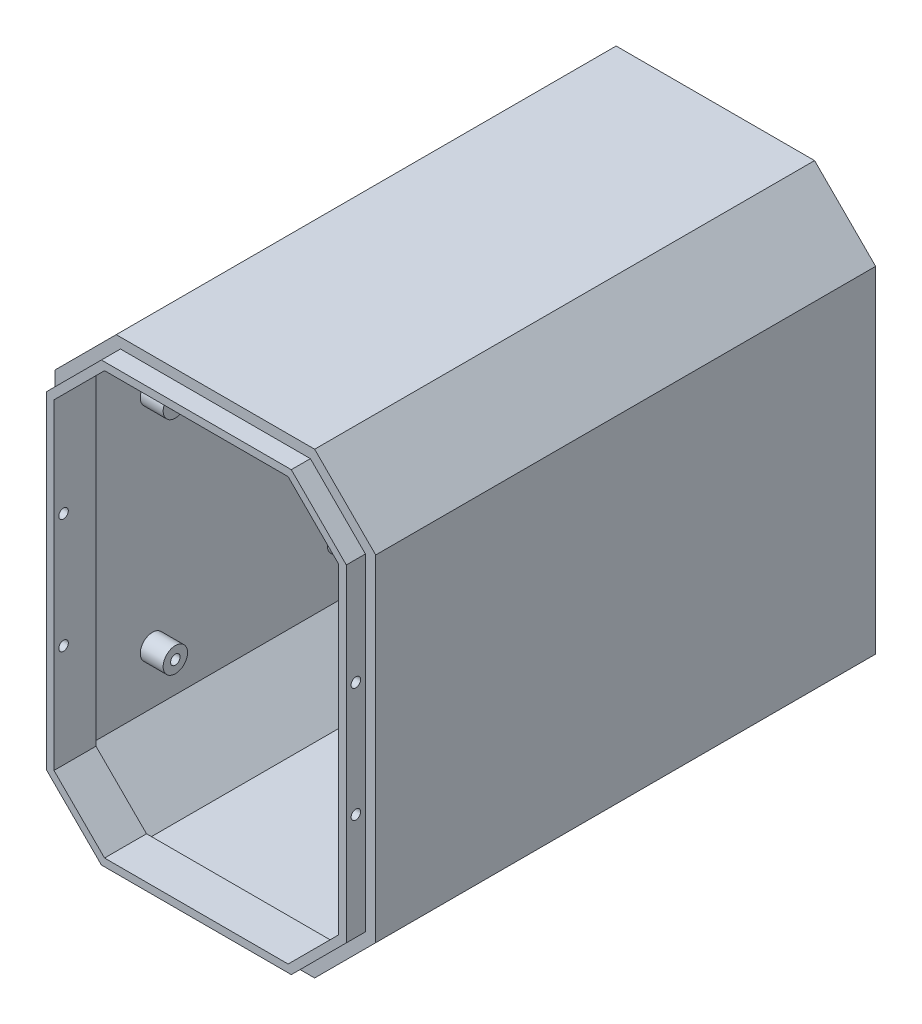
from build123d import *

# Parameters (mm, degrees)
BOSS_1_DEPTH   = 131
CUT_2_DEPTH    = 96.975
CUT_3_DEPTH    = 31.725
S_CUT4_W       = 8
S_CUT4_H       = 28
POCKET_4_DEPTH = 2.7
S_HOLE5_R      = 6
HOLE_5_DEPTH   = 2.7
S_HOLE6_R      = 1.6
HOLE_6_DEPTH   = 2.7
S_HOLE7_R      = 1.6
HOLE_7_DEPTH   = 2.7
S_HOLE8_R      = 1.6
HOLE_8_DEPTH   = 2.7
S_HOLE9_R      = 1.6
HOLE_9_DEPTH   = 2.7
BOSS_10_DEPTH  = 6
BOSS_11_DEPTH  = 5.1
S_CYL12_R      = 3.2
BOSS_12_DEPTH  = 6.5
S_CYL13_R      = 3.2
BOSS_13_DEPTH  = 6.5
S_CYL14_R      = 3.2
BOSS_14_DEPTH  = 6.5
S_CYL15_R      = 3.2
BOSS_15_DEPTH  = 6.5
CUT_16_DEPTH   = 11.2
S_HOLE17_R     = 1.25
HOLE_17_DEPTH  = 2.7
S_HOLE18_R     = 1.25
HOLE_18_DEPTH  = 2.7
S_HOLE19_R     = 1.25
HOLE_19_DEPTH  = 2.7
S_HOLE20_R     = 1.25
HOLE_20_DEPTH  = 2.7
S_HOLE21_R     = 1.25
HOLE_21_DEPTH  = 6.1
S_HOLE22_R     = 1.25
HOLE_22_DEPTH  = 6.1
S_HOLE23_R     = 1.25
HOLE_23_DEPTH  = 6.1
S_HOLE24_R     = 1.25
HOLE_24_DEPTH  = 6.1


with BuildPart() as part:
    # S_prism1 → Boss_1 (new body)
    with BuildSketch(Plane.XY.offset(37)):
        Polygon((42, -44), (42, 44), (26, 60), (-26, 60), (-42, 44), (-42, -44), (-26, -60), (26, -60), align=None)
    extrude(amount=BOSS_1_DEPTH)

    # S_pcut2 → Cut_2 (cut)
    with BuildSketch(Plane.XY.offset(71.125)):
        Polygon((39.5, -42.964466094), (39.5, 42.964466094), (24.964466094, 57.5), (-24.964466094, 57.5), (-39.5, 42.964466094), (-39.5, -42.964466094), (-24.964466094, -57.5), (24.964466094, -57.5), align=None)
    extrude(amount=CUT_2_DEPTH, mode=Mode.SUBTRACT)

    # S_pcut3 → Cut_3 (cut)
    with BuildSketch(Plane.XY.offset(36.9)):
        Polygon((39.5, -42.964466094), (39.5, 42.964466094), (24.964466094, 57.5), (-24.964466094, 57.5), (-39.5, 42.964466094), (-39.5, -42.964466094), (-24.964466094, -57.5), (24.964466094, -57.5), align=None)
    extrude(amount=CUT_3_DEPTH, mode=Mode.SUBTRACT)

    # S_cut4 → Pocket_4 (cut)
    with BuildSketch(Plane.XY.offset(68.525)):
        with Locations((-30, 0)):
            Rectangle(S_CUT4_W, S_CUT4_H)
    extrude(amount=POCKET_4_DEPTH, mode=Mode.SUBTRACT)

    # S_hole5 → Hole_5 (cut)
    with BuildSketch(Plane(origin=(-42.1, 0, 0), x_dir=(0, 0, -1), z_dir=(1, 0, 0))):
        with Locations((-88, 0)):
            Circle(S_HOLE5_R)
    extrude(amount=HOLE_5_DEPTH, mode=Mode.SUBTRACT)

    # S_hole6 → Hole_6 (cut)
    with BuildSketch(Plane.XY.offset(68.525)):
        with Locations((-20, -25)):
            Circle(S_HOLE6_R)
    extrude(amount=HOLE_6_DEPTH, mode=Mode.SUBTRACT)

    # S_hole7 → Hole_7 (cut)
    with BuildSketch(Plane.XY.offset(68.525)):
        with Locations((-20, 25)):
            Circle(S_HOLE7_R)
    extrude(amount=HOLE_7_DEPTH, mode=Mode.SUBTRACT)

    # S_hole8 → Hole_8 (cut)
    with BuildSketch(Plane.XY.offset(68.525)):
        with Locations((24, -25)):
            Circle(S_HOLE8_R)
    extrude(amount=HOLE_8_DEPTH, mode=Mode.SUBTRACT)

    # S_hole9 → Hole_9 (cut)
    with BuildSketch(Plane.XY.offset(68.525)):
        with Locations((24, 25)):
            Circle(S_HOLE9_R)
    extrude(amount=HOLE_9_DEPTH, mode=Mode.SUBTRACT)

    # S_prism10 → Boss_10 (add)
    with BuildSketch(Plane.XY.offset(162)):
        Polygon((40, -43.171572875), (40, 43.171572875), (25.171572875, 58), (-25.171572875, 58), (-40, 43.171572875), (-40, -43.171572875), (-25.171572875, -58), (25.171572875, -58), align=None)
    extrude(amount=BOSS_10_DEPTH)

    # S_prism11 → Boss_11 (add)
    with BuildSketch(Plane.XY.offset(167.9)):
        Polygon((39.3, -42.881623382), (39.3, 42.881623382), (24.881623382, 57.3), (-24.881623382, 57.3), (-39.3, 42.881623382), (-39.3, -42.881623382), (-24.881623382, -57.3), (24.881623382, -57.3), align=None)
    extrude(amount=BOSS_11_DEPTH)

    # S_cyl12 → Boss_12 (add)
    with BuildSketch(Plane(origin=(-40, 0, 0), x_dir=(0, 0, -1), z_dir=(1, 0, 0))):
        with Locations((-96, -29)):
            Circle(S_CYL12_R)
    extrude(amount=BOSS_12_DEPTH)

    # S_cyl13 → Boss_13 (add)
    with BuildSketch(Plane(origin=(-40, 0, 0), x_dir=(0, 0, -1), z_dir=(1, 0, 0))):
        with Locations((-145, -29)):
            Circle(S_CYL13_R)
    extrude(amount=BOSS_13_DEPTH)

    # S_cyl14 → Boss_14 (add)
    with BuildSketch(Plane(origin=(-40, 0, 0), x_dir=(0, 0, -1), z_dir=(1, 0, 0))):
        with Locations((-96, 29)):
            Circle(S_CYL14_R)
    extrude(amount=BOSS_14_DEPTH)

    # S_cyl15 → Boss_15 (add)
    with BuildSketch(Plane(origin=(-40, 0, 0), x_dir=(0, 0, -1), z_dir=(1, 0, 0))):
        with Locations((-145, 29)):
            Circle(S_CYL15_R)
    extrude(amount=BOSS_15_DEPTH)

    # S_pcut16 → Cut_16 (cut)
    with BuildSketch(Plane.XY.offset(161.9)):
        Polygon((37.3, -42.053196257), (37.3, 42.053196257), (24.053196257, 55.3), (-24.053196257, 55.3), (-37.3, 42.053196257), (-37.3, -42.053196257), (-24.053196257, -55.3), (24.053196257, -55.3), align=None)
    extrude(amount=CUT_16_DEPTH, mode=Mode.SUBTRACT)

    # S_hole17 → Hole_17 (cut)
    with BuildSketch(Plane(origin=(37.1, 0, 0), x_dir=(0, 0, -1), z_dir=(1, 0, 0))):
        with Locations((-170.5, -15)):
            Circle(S_HOLE17_R)
    extrude(amount=HOLE_17_DEPTH, mode=Mode.SUBTRACT)

    # S_hole18 → Hole_18 (cut)
    with BuildSketch(Plane(origin=(37.1, 0, 0), x_dir=(0, 0, -1), z_dir=(1, 0, 0))):
        with Locations((-170.5, 15)):
            Circle(S_HOLE18_R)
    extrude(amount=HOLE_18_DEPTH, mode=Mode.SUBTRACT)

    # S_hole19 → Hole_19 (cut)
    with BuildSketch(Plane(origin=(-39.8, 0, 0), x_dir=(0, 0, -1), z_dir=(1, 0, 0))):
        with Locations((-170.5, -15)):
            Circle(S_HOLE19_R)
    extrude(amount=HOLE_19_DEPTH, mode=Mode.SUBTRACT)

    # S_hole20 → Hole_20 (cut)
    with BuildSketch(Plane(origin=(-39.8, 0, 0), x_dir=(0, 0, -1), z_dir=(1, 0, 0))):
        with Locations((-170.5, 15)):
            Circle(S_HOLE20_R)
    extrude(amount=HOLE_20_DEPTH, mode=Mode.SUBTRACT)

    # S_hole21 → Hole_21 (cut)
    with BuildSketch(Plane(origin=(-39.5, 0, 0), x_dir=(0, 0, -1), z_dir=(1, 0, 0))):
        with Locations((-96, -29)):
            Circle(S_HOLE21_R)
    extrude(amount=HOLE_21_DEPTH, mode=Mode.SUBTRACT)

    # S_hole22 → Hole_22 (cut)
    with BuildSketch(Plane(origin=(-39.5, 0, 0), x_dir=(0, 0, -1), z_dir=(1, 0, 0))):
        with Locations((-145, -29)):
            Circle(S_HOLE22_R)
    extrude(amount=HOLE_22_DEPTH, mode=Mode.SUBTRACT)

    # S_hole23 → Hole_23 (cut)
    with BuildSketch(Plane(origin=(-39.5, 0, 0), x_dir=(0, 0, -1), z_dir=(1, 0, 0))):
        with Locations((-96, 29)):
            Circle(S_HOLE23_R)
    extrude(amount=HOLE_23_DEPTH, mode=Mode.SUBTRACT)

    # S_hole24 → Hole_24 (cut)
    with BuildSketch(Plane(origin=(-39.5, 0, 0), x_dir=(0, 0, -1), z_dir=(1, 0, 0))):
        with Locations((-145, 29)):
            Circle(S_HOLE24_R)
    extrude(amount=HOLE_24_DEPTH, mode=Mode.SUBTRACT)


solid = part.part
